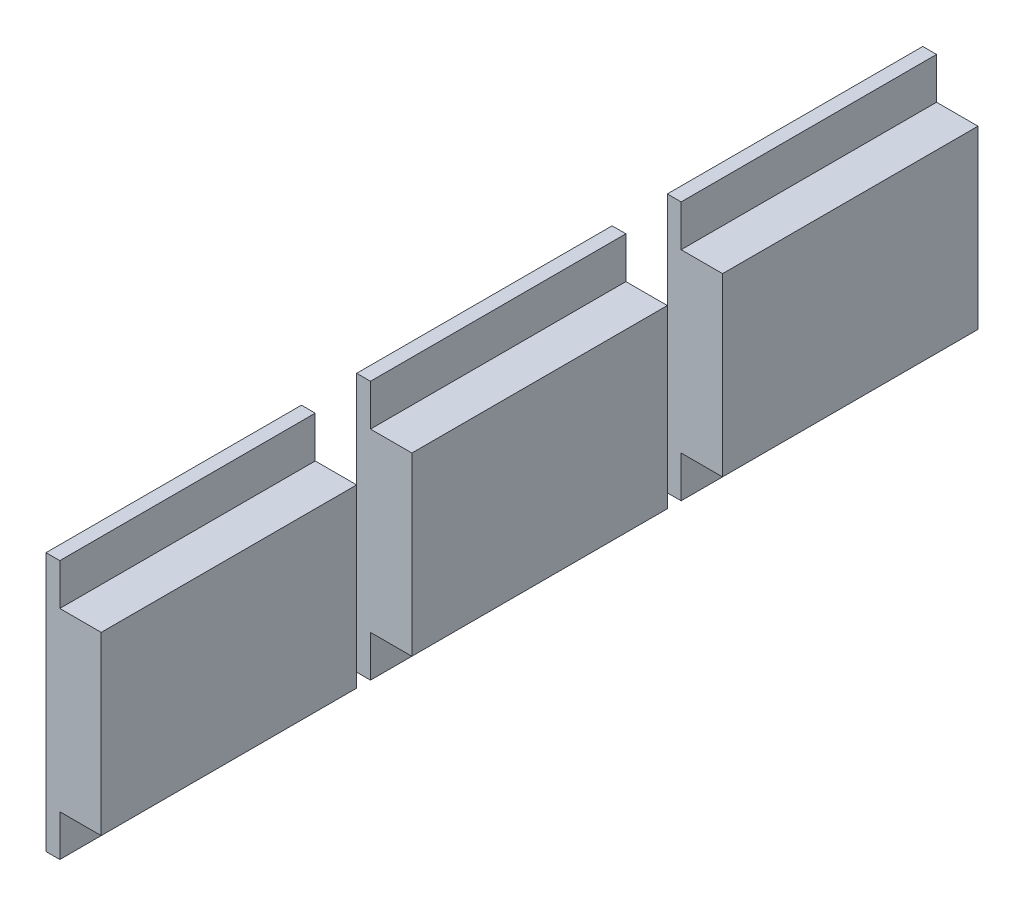
from build123d import *

# Parameters (mm, degrees)
AUFSATZ_LINEAR_START                = -0.4
AUFSATZ_LINEAR_AUSTRAGEN1_OUTLINE_W = 7.4
AUFSATZ_LINEAR_AUSTRAGEN1_OUTLINE_H = 7.5
AUFSATZ_LINEAR_AUSTRAGEN1_DEPTH     = 0.4
SKIZZE3_W                           = 7.4
SKIZZE3_H                           = 5.1
AUFSATZ_LINEAR_AUSTRAGEN2_DEPTH     = 1.2
LINEARES_MUSTER1_COUNT              = 3
LINEARES_MUSTER1_PITCH              = 9


# Read off the part's stored shape, not the designer's step: Aufsatz-Linear austragen1
with BuildPart() as part:
    # Aufsatz-Linear austragen1 outline → Aufsatz-Linear austragen1 (new body)
    with BuildSketch(Plane(origin=(87.8, 0, 0), x_dir=(0, 0, -1), z_dir=(1, 0, 0)).offset(AUFSATZ_LINEAR_START)):
        with Locations((34.89, 13.1)):
            Rectangle(AUFSATZ_LINEAR_AUSTRAGEN1_OUTLINE_W, AUFSATZ_LINEAR_AUSTRAGEN1_OUTLINE_H)
    extrude(amount=AUFSATZ_LINEAR_AUSTRAGEN1_DEPTH)

    # Skizze3 → Aufsatz-Linear austragen2 (add)
    with BuildSketch(Plane(origin=(87.8, 0, 0), x_dir=(0, 0, -1), z_dir=(1, 0, 0))):
        with Locations((34.89, 13.1)):
            Rectangle(SKIZZE3_W, SKIZZE3_H)
    extrude(amount=AUFSATZ_LINEAR_AUSTRAGEN2_DEPTH)


with BuildPart() as lineares_muster1_1:
    # Lineares Muster1: pattern copy
    add(part.part.moved(Location(Vector(0, 0, -1) * (1 * LINEARES_MUSTER1_PITCH))))


with BuildPart() as lineares_muster1_2:
    # Lineares Muster1: pattern copy
    add(part.part.moved(Location(Vector(0, 0, -1) * (2 * LINEARES_MUSTER1_PITCH))))


solid = Compound([part.part, lineares_muster1_1.part, lineares_muster1_2.part])
